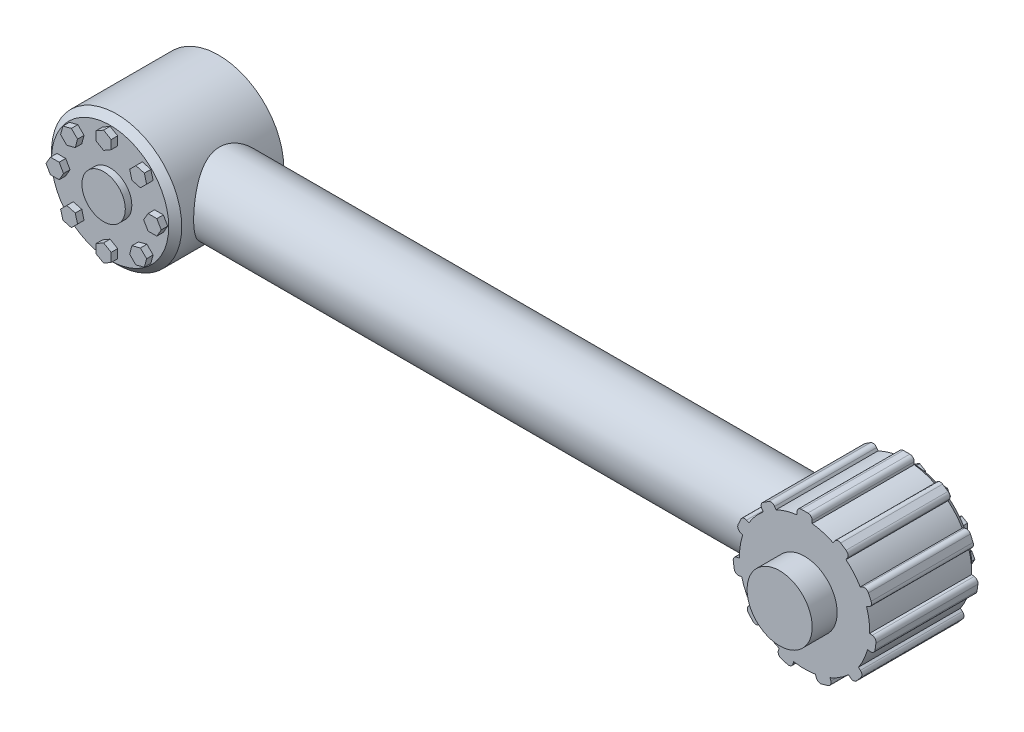
from build123d import *

# Parameters (mm, degrees)
SKETCH1_R            = 30
BOSS_EXTRUDE1_DEPTH  = 25
SKETCH2_R            = 15
BOSS_EXTRUDE2_DEPTH  = 11.5
BOSS_EXTRUDE3_DEPTH  = 3
CHAMFER1_SIZE        = 3
SKETCH4_R            = 17.5
BOSS_EXTRUDE4_DEPTH  = 320
CUT_EXTRUDE1_START   = -23
SKETCH6_R            = 15
CUT_EXTRUDE1_DEPTH   = 23
BOSS_EXTRUDE6_DEPTH  = 3
CHAMFER2_SIZE        = 3
SKETCH8_R            = 15
BOSS_EXTRUDE7_DEPTH  = 11.5
SKETCH9_W            = 7
SKETCH9_H            = 47
BOSS_EXTRUDE8_DEPTH  = 33
FILLET1_R            = 2
CIRPATTERN1_START    = -22
CIRPATTERN1_DEPTH    = 47
CIRPATTERN1_2_DEPTH  = 16.428723176
SKETCH10_R           = 10
BOSS_EXTRUDE9_DEPTH  = 3
SKETCH11_R           = 10
BOSS_EXTRUDE10_DEPTH = 3


# Read off the part's stored shape, not the designer's step: CirPattern1
with BuildPart() as part:
    # Sketch1 → Boss-Extrude1 (new, symmetric)
    with BuildSketch(Plane.XY):
        Circle(SKETCH1_R)
    boss_extrude1 = extrude(amount=BOSS_EXTRUDE1_DEPTH, both=True)

    # Sketch2 → Boss-Extrude2 (add)
    with BuildSketch(Plane(origin=(0, 0, -25), x_dir=(-1, 0, 0), z_dir=(0, 0, -1))):
        with Locations(Location((0, 0, 0), (0, 0, 180))):
            Circle(SKETCH2_R)
    extrude(amount=BOSS_EXTRUDE2_DEPTH)

    # Sketch3 → Boss-Extrude3 (add)
    with BuildSketch(Plane.XY.offset(25)):
        Polygon((19.813645327, 14.863897859), (18.76764061, 18.76764061), (14.863897859, 19.813645327), (12.006159826, 16.955907294), (13.052164543, 13.052164543), (16.955907294, 12.006159826), align=None)
        Polygon((0, 18.458548116), (3.5, 20.479274058), (3.5, 24.520725942), (0, 26.541451884), (-3.5, 24.520725942), (-3.5, 20.479274058), align=None)
        Polygon((24.520725942, -3.5), (26.541451884, 0), (24.520725942, 3.5), (20.479274058, 3.5), (18.458548116, 0), (20.479274058, -3.5), align=None)
        Polygon((14.863897859, -19.813645327), (18.76764061, -18.76764061), (19.813645327, -14.863897859), (16.955907294, -12.006159826), (13.052164543, -13.052164543), (12.006159826, -16.955907294), align=None)
        Polygon((-3.5, -24.520725942), (0, -26.541451884), (3.5, -24.520725942), (3.5, -20.479274058), (0, -18.458548116), (-3.5, -20.479274058), align=None)
        Polygon((-19.813645327, -14.863897859), (-18.76764061, -18.76764061), (-14.863897859, -19.813645327), (-12.006159826, -16.955907294), (-13.052164543, -13.052164543), (-16.955907294, -12.006159826), align=None)
        Polygon((-24.520725942, 3.5), (-26.541451884, 0), (-24.520725942, -3.5), (-20.479274058, -3.5), (-18.458548116, 0), (-20.479274058, 3.5), align=None)
        Polygon((-14.863897859, 19.813645327), (-18.76764061, 18.76764061), (-19.813645327, 14.863897859), (-16.955907294, 12.006159826), (-13.052164543, 13.052164543), (-12.006159826, 16.955907294), align=None)
    extrude(amount=BOSS_EXTRUDE3_DEPTH)

    # Chamfer1
    chamfer1_edges = [part.edges().sort_by_distance(p)[0] for p in [
        (-30, 0, 25),
    ]]
    chamfer(chamfer1_edges, length=CHAMFER1_SIZE)

    # Sketch4 → Boss-Extrude4 (add)
    with BuildSketch(Plane(origin=(0, 0, 0), x_dir=(0, 0, -1), z_dir=(1, 0, 0))):
        with Locations((1, 0)):
            Circle(SKETCH4_R)
    extrude(amount=BOSS_EXTRUDE4_DEPTH)

    # Sketch6 → Cut-Extrude1 (cut)
    with BuildSketch(Plane(origin=(0, 0, -36.5), x_dir=(-1, 0, 0), z_dir=(0, 0, -1)).offset(CUT_EXTRUDE1_START)):
        Circle(SKETCH6_R)
    extrude(amount=CUT_EXTRUDE1_DEPTH, mode=Mode.SUBTRACT)

    # Mirror4: Boss-Extrude1 across plane
    add(boss_extrude1.mirror(Plane(origin=(160, 0, 0), x_dir=(0, 0, 1), z_dir=(1, 0, 0))))

    # Sketch7 → Boss-Extrude6 (add)
    with BuildSketch(Plane(origin=(0, 0, -25), x_dir=(-1, 0, 0), z_dir=(0, 0, -1))):
        Polygon((-310.25, 16.887495374), (-307.25, 16.887495374), (-305.75, 19.485571585), (-307.25, 22.083647797), (-310.25, 22.083647797), (-311.75, 19.485571585), align=None)
        Polygon((-320, 19.5), (-317.401923789, 21), (-317.401923789, 24), (-320, 25.5), (-322.598076211, 24), (-322.598076211, 21), align=None)
        Polygon((-303.112504626, 9.75), (-300.514428415, 8.25), (-297.916352203, 9.75), (-297.916352203, 12.75), (-300.514428415, 14.25), (-303.112504626, 12.75), align=None)
        Polygon((-300.5, 0), (-299, -2.598076211), (-296, -2.598076211), (-294.5, 0), (-296, 2.598076211), (-299, 2.598076211), align=None)
        Polygon((-303.112504626, -9.75), (-303.112504626, -12.75), (-300.514428415, -14.25), (-297.916352203, -12.75), (-297.916352203, -9.75), (-300.514428415, -8.25), align=None)
        Polygon((-310.25, -16.887495374), (-311.75, -19.485571585), (-310.25, -22.083647797), (-307.25, -22.083647797), (-305.75, -19.485571585), (-307.25, -16.887495374), align=None)
        Polygon((-320, -19.5), (-322.598076211, -21), (-322.598076211, -24), (-320, -25.5), (-317.401923789, -24), (-317.401923789, -21), align=None)
        Polygon((-329.75, -16.887495374), (-332.75, -16.887495374), (-334.25, -19.485571585), (-332.75, -22.083647797), (-329.75, -22.083647797), (-328.25, -19.485571585), align=None)
        Polygon((-336.887495374, -9.75), (-339.485571585, -8.25), (-342.083647796, -9.75), (-342.083647796, -12.75), (-339.485571585, -14.25), (-336.887495374, -12.75), align=None)
        Polygon((-339.5, 0), (-341, 2.598076211), (-344, 2.598076211), (-345.5, 0), (-344, -2.598076211), (-341, -2.598076211), align=None)
        Polygon((-336.887495374, 9.75), (-336.887495374, 12.75), (-339.485571585, 14.25), (-342.083647797, 12.75), (-342.083647797, 9.75), (-339.485571585, 8.25), align=None)
        Polygon((-329.75, 16.887495374), (-328.25, 19.485571585), (-329.75, 22.083647797), (-332.75, 22.083647797), (-334.25, 19.485571585), (-332.75, 16.887495374), align=None)
    extrude(amount=BOSS_EXTRUDE6_DEPTH)

    # Chamfer2
    chamfer2_edges = [part.edges().sort_by_distance(p)[0] for p in [
        (350, 0, -25),
    ]]
    chamfer(chamfer2_edges, length=CHAMFER2_SIZE)

    # Sketch8 → Boss-Extrude7 (add)
    with BuildSketch(Plane.XY.offset(25)):
        with Locations((320, 0)):
            Circle(SKETCH8_R)
    extrude(amount=BOSS_EXTRUDE7_DEPTH)

    # Sketch9 → Boss-Extrude8 (add)
    with BuildSketch(Plane(origin=(0, 0, 0), x_dir=(1, 0, 0), z_dir=(0, 1, 0))):
        with Locations((320, -1.5)):
            Rectangle(SKETCH9_W, SKETCH9_H)
    extrude(amount=BOSS_EXTRUDE8_DEPTH)

    # Fillet1
    fillet1_edges = [part.edges().sort_by_distance(p)[0] for p in [
        (316.5, 33, 1.5),
        (323.5, 33, 1.5),
    ]]
    fillet(fillet1_edges, radius=FILLET1_R)

    # CirPattern1 outline → CirPattern1 (add)
    with BuildSketch(Plane.XY.offset(CIRPATTERN1_START)):
        with BuildLine():
            Line((300.295747294, 24.186616657), (300.947147125, 23.173018735))
            ThreePointArc((300.947147125, 23.173018735), (303.780775476, 25.237605985), (306.835921854, 26.957504457))
            Line((306.835921854, 26.957504457), (306.184522024, 27.971102379))
            ThreePointArc((306.184522024, 27.971102379), (304.927145537, 28.844114476), (303.420733323, 28.57232781))
            Line((303.420733323, 28.57232781), (300.896972725, 26.950405357))
            ThreePointArc((300.896972725, 26.950405357), (300.023960628, 25.693028871), (300.295747294, 24.186616657))
        make_face()
        with BuildLine():
            Line((290.347455599, 9.694153419), (291.443440437, 9.19363399))
            ThreePointArc((291.443440437, 9.19363399), (292.71104015, 12.462450413), (294.351345498, 15.561057876))
            Line((294.351345498, 15.561057876), (293.25536069, 16.061577387))
            ThreePointArc((293.25536069, 16.061577387), (291.725602305, 16.116212846), (290.605266673, 15.073143422))
            Line((290.605266673, 15.073143422), (289.359021634, 12.344247436))
            ThreePointArc((289.359021634, 12.344247436), (289.304386175, 10.814489051), (290.347455599, 9.694153419))
        make_face()
        with BuildLine():
            Line((289.813637236, -7.876135033), (291.006239527, -7.704664409))
            ThreePointArc((291.006239527, -7.704664409), (290.305356722, -4.269445002), (290.010035737, -0.77591461))
            Line((290.010035737, -0.77591461), (288.817433368, -0.94738494))
            ThreePointArc((288.817433368, -0.94738494), (287.500980562, -1.72847249), (287.122420161, -3.2116575))
            Line((287.122420161, -3.2116575), (287.549364675, -6.181121826))
            ThreePointArc((287.549364675, -6.181121826), (288.330452226, -7.497574631), (289.813637236, -7.876135033))
        make_face()
        with BuildLine():
            Line((298.863775764, -22.945806263), (299.774352858, -22.156786719))
            ThreePointArc((299.774352858, -22.156786719), (297.327512801, -19.645822055), (295.190327775, -16.866539779))
            Line((295.190327775, -16.866539779), (294.279750626, -17.655559242))
            ThreePointArc((294.279750626, -17.655559242), (293.594567865, -19.024380025), (294.077972945, -20.476779859))
            Line((294.077972945, -20.476779859), (296.042555147, -22.744028582))
            ThreePointArc((296.042555147, -22.744028582), (297.41137593, -23.429211343), (298.863775764, -22.945806263))
        make_face()
        with BuildLine():
            Line((314.624516146, -30.730346131), (314.963966172, -29.574285508))
            ThreePointArc((314.963966172, -29.574285508), (311.548023295, -28.784789208), (308.247515357, -27.60215761))
            Line((308.247515357, -27.60215761), (307.90806533, -28.758218233))
            ThreePointArc((307.90806533, -28.758218233), (308.071693298, -30.28018132), (309.263586164, -31.240669294))
            Line((309.263586164, -31.240669294), (312.142065085, -32.085866965))
            ThreePointArc((312.142065085, -32.085866965), (313.664028172, -31.922238996), (314.624516146, -30.730346131))
        make_face()
        with BuildLine():
            Line((332.09193467, -28.758218233), (331.752484643, -27.60215761))
            ThreePointArc((331.752484643, -27.60215761), (328.451976705, -28.784789208), (325.036033828, -29.574285508))
            Line((325.036033828, -29.574285508), (325.375483854, -30.730346131))
            ThreePointArc((325.375483854, -30.730346131), (326.335971828, -31.922238996), (327.857934915, -32.085866965))
            Line((327.857934915, -32.085866965), (330.736413836, -31.240669294))
            ThreePointArc((330.736413836, -31.240669294), (331.928306702, -30.28018132), (332.09193467, -28.758218233))
        make_face()
        with BuildLine():
            Line((345.720249374, -17.655559242), (344.809672279, -16.866539698))
            ThreePointArc((344.809672279, -16.866539698), (342.672487231, -19.645822018), (340.225647142, -22.156786719))
            Line((340.225647142, -22.156786719), (341.136224236, -22.945806263))
            ThreePointArc((341.136224236, -22.945806263), (342.58862407, -23.429211343), (343.957444853, -22.744028582))
            Line((343.957444853, -22.744028582), (345.922027055, -20.476779859))
            ThreePointArc((345.922027055, -20.476779859), (346.405432135, -19.024380025), (345.720249374, -17.655559242))
        make_face()
        with BuildLine():
            Line((351.182566632, -0.94738494), (349.989964264, -0.775914606))
            ThreePointArc((349.989964264, -0.775914606), (349.694643256, -4.269445148), (348.993760396, -7.704664699))
            Line((348.993760396, -7.704664699), (350.186362764, -7.876135033))
            ThreePointArc((350.186362764, -7.876135033), (351.669547774, -7.497574631), (352.450635325, -6.181121826))
            Line((352.450635325, -6.181121826), (352.877579839, -3.2116575))
            ThreePointArc((352.877579839, -3.2116575), (352.499019438, -1.72847249), (351.182566632, -0.94738494))
        make_face()
        with BuildLine():
            ThreePointArc((333.164078146, 26.957504457), (336.219224524, 25.237605985), (339.052852875, 23.173018735))
            Line((339.052852875, 23.173018735), (339.704252706, 24.186616657))
            ThreePointArc((339.704252706, 24.186616657), (339.976039372, 25.693028871), (339.103027275, 26.950405357))
            Line((339.103027275, 26.950405357), (336.579266677, 28.57232781))
            ThreePointArc((336.579266677, 28.57232781), (335.072854463, 28.844114476), (333.815477976, 27.971102379))
            Line((333.815477976, 27.971102379), (333.164078146, 26.957504457))
        make_face()
        with BuildLine():
            Line((350.640978366, 12.344247436), (349.394733327, 15.073143422))
            ThreePointArc((349.394733327, 15.073143422), (348.274397695, 16.116212846), (346.74463931, 16.061577387))
            Line((346.74463931, 16.061577387), (345.648654493, 15.561057891))
            ThreePointArc((345.648654493, 15.561057891), (347.288959861, 12.46245039), (348.556559584, 9.193633924))
            Line((348.556559584, 9.193633924), (349.652544401, 9.694153419))
            ThreePointArc((349.652544401, 9.694153419), (350.695613825, 10.814489051), (350.640978366, 12.344247436))
        make_face()
    extrude(amount=CIRPATTERN1_DEPTH)

    # CirPattern1 2 outline → CirPattern1 2 (add)
    with BuildSketch(Plane.XY.offset(CIRPATTERN1_START)):
        with BuildLine():
            Line((287.833994352, -8.16076471), (289.813637236, -7.876135033))
            ThreePointArc((289.813637236, -7.876135033), (288.330452226, -7.497574631), (287.549364675, -6.181121826))
            Line((287.549364675, -6.181121826), (287.833994352, -8.16076471))
        make_face()
        with BuildLine():
            ThreePointArc((287.122420161, -3.2116575), (287.500980562, -1.72847249), (288.817433368, -0.94738494))
            Line((288.817433368, -0.94738494), (286.837790484, -1.232014616))
            Line((286.837790484, -1.232014616), (287.122420161, -3.2116575))
        make_face()
        with BuildLine():
            Line((288.528191608, 10.524983445), (290.347455599, 9.694153419))
            ThreePointArc((290.347455599, 9.694153419), (289.304386175, 10.814489051), (289.359021634, 12.344247436))
            Line((289.359021634, 12.344247436), (288.528191608, 10.524983445))
        make_face()
        with BuildLine():
            ThreePointArc((290.605266673, 15.073143422), (291.725602305, 16.116212846), (293.25536069, 16.061577387))
            Line((293.25536069, 16.061577387), (291.436096699, 16.892407413))
            Line((291.436096699, 16.892407413), (290.605266673, 15.073143422))
        make_face()
    extrude(amount=CIRPATTERN1_2_DEPTH)

    # Sketch10 → Boss-Extrude9 (add)
    with BuildSketch(Plane(origin=(0, 0, -25), x_dir=(-1, 0, 0), z_dir=(0, 0, -1))):
        with Locations(Location((-320, 0, 0), (0, 0, 180))):
            Circle(SKETCH10_R)
    extrude(amount=BOSS_EXTRUDE9_DEPTH)

    # Sketch11 → Boss-Extrude10 (add)
    with BuildSketch(Plane.XY.offset(25)):
        Circle(SKETCH11_R)
    extrude(amount=BOSS_EXTRUDE10_DEPTH)


solid = part.part
